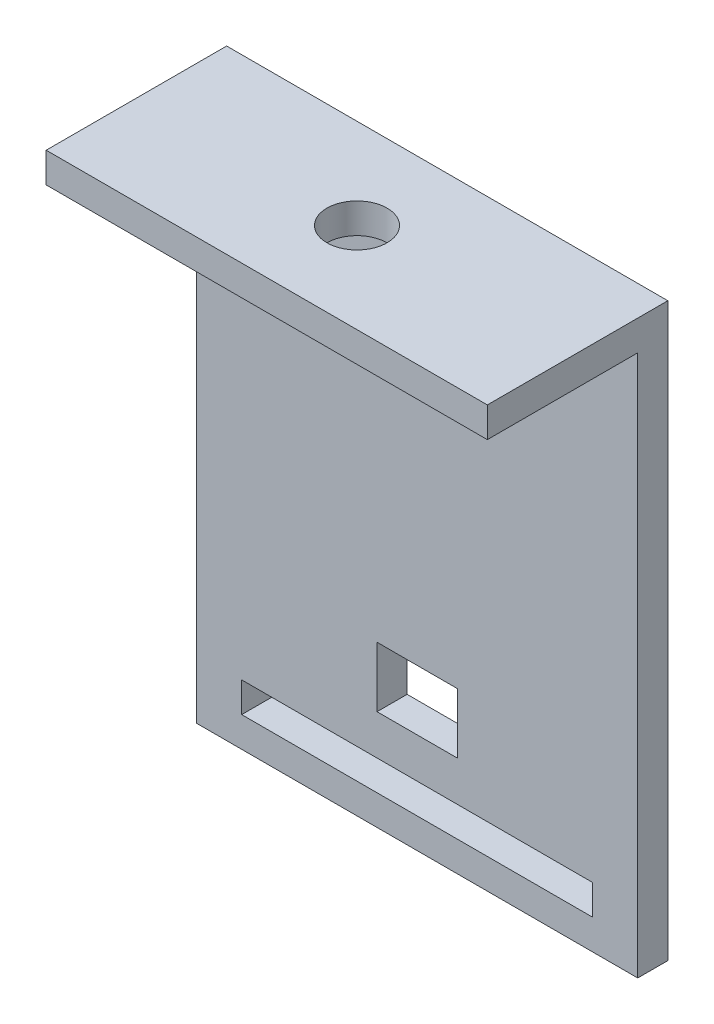
from build123d import *

# Parameters (mm, degrees)
ESTRUSIONE_ESTRUSIONE6_DEPTH = 44
SCHIZZO9_W                   = 35
SCHIZZO9_H                   = 3
TAGLIO_ESTRUSIONE2_DEPTH     = 44
SCHIZZO10_R                  = 3
TAGLIO_ESTRUSIONE3_DEPTH     = 10
SCHIZZO11_W                  = 8
SCHIZZO11_H                  = 6
TAGLIO_ESTRUSIONE4_DEPTH     = 10


with BuildPart() as part:
    # Schizzo8 → Estrusione-Estrusione6 (new body)
    with BuildSketch(Plane(origin=(0, 0, 0), x_dir=(0, 0, -1), z_dir=(1, 0, 0))):
        Polygon((0, 0), (0, 3), (18, 3), (18, -54), (15, -54), (15, 0), align=None)
    extrude(amount=ESTRUSIONE_ESTRUSIONE6_DEPTH)

    # Schizzo9 → Taglio-Estrusione2 (cut)
    with BuildSketch(Plane.XY.offset(-15)):
        with Locations((22, -49.5)):
            Rectangle(SCHIZZO9_W, SCHIZZO9_H)
    extrude(amount=-TAGLIO_ESTRUSIONE2_DEPTH, mode=Mode.SUBTRACT)

    # Schizzo10 → Taglio-Estrusione3 (cut)
    with BuildSketch(Plane(origin=(0, 3, 0), x_dir=(1, 0, 0), z_dir=(0, 1, 0))):
        with Locations((22, 9)):
            Circle(SCHIZZO10_R)
    extrude(amount=-TAGLIO_ESTRUSIONE3_DEPTH, mode=Mode.SUBTRACT)

    # Schizzo11 → Taglio-Estrusione4 (cut)
    with BuildSketch(Plane(origin=(0, 0, -18), x_dir=(-1, 0, 0), z_dir=(0, 0, -1))):
        with Locations((-22, -41)):
            Rectangle(SCHIZZO11_W, SCHIZZO11_H)
    extrude(amount=-TAGLIO_ESTRUSIONE4_DEPTH, mode=Mode.SUBTRACT)


solid = part.part
